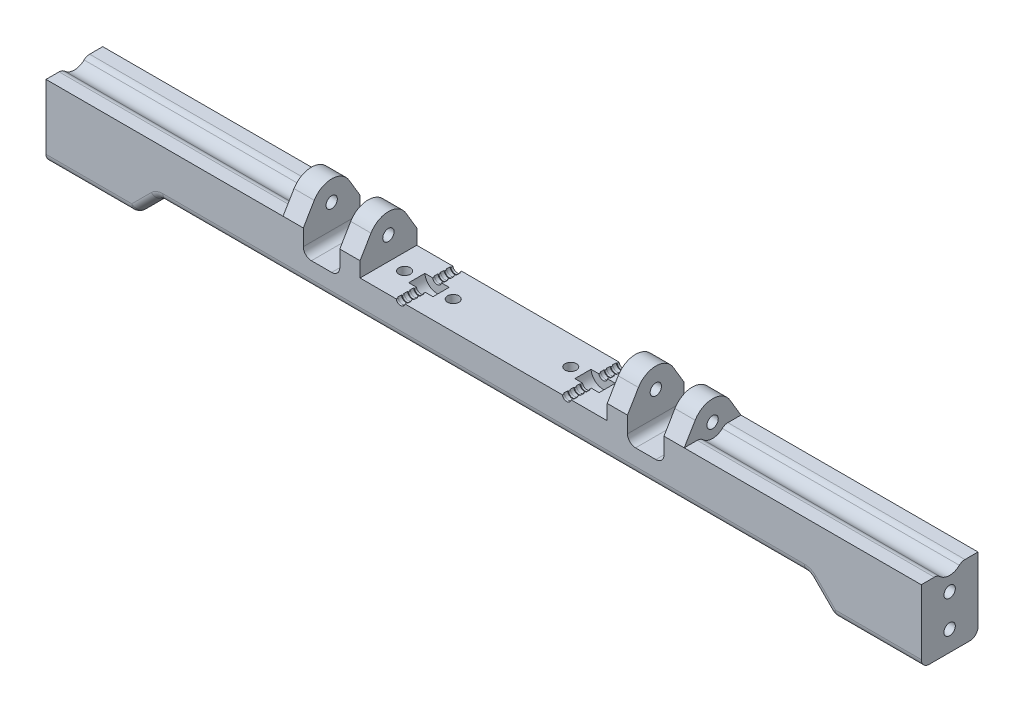
from build123d import *

# Parameters (mm, degrees)
SKETCH1_W           = 17.78
SKETCH1_H           = 22.86
BOSS_EXTRUDE1_DEPTH = 137.16
SKETCH3_R           = 1.778
CUT_EXTRUDE2_DEPTH  = 63.5
SKETCH4_R           = 1.778
BOSS_EXTRUDE2_DEPTH = 6.35
CUT_EXTRUDE3_DEPTH  = 11.43
CUT_EXTRUDE5_DEPTH  = 140.792333123
SKETCH8_R           = 1.778
CUT_EXTRUDE6_DEPTH  = 139.642416385
BOSS_EXTRUDE3_DEPTH = 0.635
LPATTERN1_COUNT     = 10
LPATTERN1_PITCH     = 1.905
SKETCH10_R          = 3.81
CUT_EXTRUDE7_DEPTH  = 2.54
SKETCH11_R          = 4.445
CUT_EXTRUDE8_DEPTH  = 202.250925774
SKETCH12_W          = 203.2
SKETCH12_H          = 7.62
CUT_EXTRUDE9_DEPTH  = 140.792333123
CHAMFER1_SIZE       = 7.62
FILLET1_R           = 2.54


# Read off the part's stored shape, not the designer's step: Mirror2
with BuildPart() as part:
    # Sketch1 → Boss-Extrude1 (new, symmetric)
    with BuildSketch(Plane(origin=(0, 0, 0), x_dir=(0, 0, -1), z_dir=(1, 0, 0))):
        Rectangle(SKETCH1_W, SKETCH1_H)
    extrude(amount=BOSS_EXTRUDE1_DEPTH, both=True)

    # Sketch3 → Cut-Extrude2 (cut)
    with BuildSketch(Plane(origin=(137.16, 0, 0), x_dir=(0, 0, -1), z_dir=(1, 0, 0))):
        with Locations((0, -5.08)):
            Circle(SKETCH3_R)
        with Locations(Location((0, 5.08, 0), (0, 0, 180))):
            Circle(SKETCH3_R)
    extrude(amount=-CUT_EXTRUDE2_DEPTH, mode=Mode.SUBTRACT)

    # Sketch4 → Boss-Extrude2 (add)
    with BuildSketch(Plane(origin=(56.515, 0, 0), x_dir=(0, 0, -1), z_dir=(1, 0, 0))):
        with BuildLine():
            Line((-8.89, 11.43), (-5.461360062, 17.209760218))
            ThreePointArc((-5.461360062, 17.209760218), (0, 20.32), (5.461360062, 17.209760218))
            Line((5.461360062, 17.209760218), (8.89, 11.43))
            Line((8.89, 11.43), (-8.89, 11.43))
        make_face()
        with Locations((0, 13.97)):
            Circle(SKETCH4_R, mode=Mode.SUBTRACT)
    boss_extrude2 = extrude(amount=BOSS_EXTRUDE2_DEPTH)

    # Mirror1: Boss-Extrude2 across plane
    add(boss_extrude2.mirror(Plane.ZY.offset(-50.8)))

    # Sketch5 → Cut-Extrude3 (cut)
    with BuildSketch(Plane(origin=(56.515, 0, 0), x_dir=(0, 0, -1), z_dir=(1, 0, 0))):
        with BuildLine():
            Line((-10.16, 13.97), (-10.16, 3.81))
            Line((-10.16, 3.81), (10.16, 3.81))
            Line((10.16, 3.81), (10.16, 13.97))
            ThreePointArc((10.16, 13.97), (0, 24.13), (-10.16, 13.97))
        make_face()
    extrude(amount=-CUT_EXTRUDE3_DEPTH, mode=Mode.SUBTRACT)

    # Sketch6 → Cut-Extrude5 (cut, through all)
    with BuildSketch(Plane.XY.offset(8.89)):
        with BuildLine():
            ThreePointArc((24.403655463, 6.731), (26.035, 5.334), (27.666344537, 6.731))
            Line((27.666344537, 6.731), (24.403655463, 6.731))
        make_face()
        with BuildLine():
            Line((24.403655463, 6.731), (27.666344537, 6.731))
            ThreePointArc((27.666344537, 6.731), (27.6810788, 6.857620314), (27.686, 6.985))
            ThreePointArc((27.686, 6.985), (25.907620314, 8.6310788), (24.403655463, 6.731))
        make_face()
        with BuildLine():
            Line((27.666344537, 6.731), (38.735, 6.731))
            Line((38.735, 6.731), (38.735, 11.43))
            Line((38.735, 11.43), (0, 11.43))
            Line((0, 11.43), (0, 6.731))
            Line((0, 6.731), (24.403655463, 6.731))
            ThreePointArc((24.403655463, 6.731), (25.907620314, 8.6310788), (27.686, 6.985))
            ThreePointArc((27.686, 6.985), (27.6810788, 6.857620314), (27.666344537, 6.731))
        make_face()
    extrude(amount=-CUT_EXTRUDE5_DEPTH, mode=Mode.SUBTRACT)

    # Sketch8 → Cut-Extrude6 (cut, through all)
    with BuildSketch(Plane(origin=(0, 6.731, 0), x_dir=(1, 0, 0), z_dir=(0, 1, 0))):
        with Locations(Location((18.415, 0, 0), (0, 0, 180))):
            Circle(SKETCH8_R)
        with Locations((33.655, 0)):
            Circle(SKETCH8_R)
    extrude(amount=-CUT_EXTRUDE6_DEPTH, mode=Mode.SUBTRACT)

    # Sketch9 → Boss-Extrude3 (add)
    with BuildSketch(Plane.XY.offset(8.89)):
        with BuildLine():
            Line((24.403655463, 6.731), (24.661284964, 6.731))
            ThreePointArc((24.661284964, 6.731), (26.035, 5.588), (27.408715036, 6.731))
            Line((27.408715036, 6.731), (27.666344537, 6.731))
            ThreePointArc((27.666344537, 6.731), (26.035, 5.334), (24.403655463, 6.731))
        make_face()
    boss_extrude3 = extrude(amount=-BOSS_EXTRUDE3_DEPTH)

    # LPattern1: Boss-Extrude3 ×10
    with Locations(*[(0, 0, -i * LPATTERN1_PITCH) for i in range(1, LPATTERN1_COUNT)]):
        add(boss_extrude3)

    # Sketch10 → Cut-Extrude7 (cut, symmetric)
    with BuildSketch(Plane.XY):
        with Locations((26.035, 6.985)):
            Circle(SKETCH10_R)
    extrude(amount=CUT_EXTRUDE7_DEPTH, both=True, mode=Mode.SUBTRACT)

    # Sketch11 → Cut-Extrude8 (cut, through all)
    with BuildSketch(Plane(origin=(62.865, 0, 0), x_dir=(0, 0, -1), z_dir=(1, 0, 0))):
        with Locations((0, 13.97)):
            Circle(SKETCH11_R)
    extrude(amount=CUT_EXTRUDE8_DEPTH, mode=Mode.SUBTRACT)

    # Mirror2
    split(bisect_by=Plane(origin=(0, 0, 0), x_dir=(0, 0, 1), z_dir=(1, 0, 0)), keep=Keep.TOP)

    # Mirror2 2: part across plane


with BuildPart() as part_1:
    add(part.part)
    add(part.part.mirror(Plane(origin=(0, 0, 0), x_dir=(0, 0, 1), z_dir=(1, 0, 0))))

    # Sketch12 → Cut-Extrude9 (cut, through all)
    with BuildSketch(Plane(origin=(0, 0, -8.89), x_dir=(-1, 0, 0), z_dir=(0, 0, -1))):
        with Locations((0, -7.62)):
            Rectangle(SKETCH12_W, SKETCH12_H)
    extrude(amount=-CUT_EXTRUDE9_DEPTH, mode=Mode.SUBTRACT)

    # Chamfer1
    # the kernel refuses this chamfer: 7.62 mm, written as the material it takes off along each edge
    with BuildSketch(Plane(origin=(-101.6, -11.43, -28.486224368), x_dir=(-0.9996219169112968, -0.02749587661058636, 0), z_dir=(0, 0, 1))) as chamfer1_piece_1:
        Polygon((CHAMFER1_SIZE * 0.999621916911, -CHAMFER1_SIZE * 0.0274958766106), (-CHAMFER1_SIZE * 0.0274958766106, -CHAMFER1_SIZE * 0.999621916911), (0, 0), align=None)
    extrude(amount=56.972448737, mode=Mode.SUBTRACT)
    with BuildSketch(Plane(origin=(101.6, -11.43, -28.486224368), x_dir=(0.9996219169112968, -0.02749587661058636, 0), z_dir=(0, 0, 1))) as chamfer1_piece_2:
        Polygon((CHAMFER1_SIZE * 0.999621916911, CHAMFER1_SIZE * 0.0274958766106), (-CHAMFER1_SIZE * 0.0274958766106, CHAMFER1_SIZE * 0.999621916911), (0, 0), align=None)
    extrude(amount=56.972448737, mode=Mode.SUBTRACT)

    # Fillet1
    fillet1_edges = [part_1.edges().sort_by_distance(p)[0] for p in [
        (100.0125, 11.43, -3.647797281),
        (100.0125, 11.43, 3.647797281),
        (-56.515, 3.81, 0),
        (-45.085, 3.81, 0),
        (-100.0125, 11.43, 3.647797281),
        (-100.0125, 11.43, -3.647797281),
        (101.6, -3.81, 5.067170395),
        (0, -3.81, 8.89),
        (-101.6, -3.81, 5.067170395),
        (0, -3.81, -8.89),
        (123.19, -11.43, -8.89),
        (105.41, -7.62, -8.89),
        (-105.41, -7.62, -8.89),
        (-109.22, -11.43, 0),
        (123.19, -11.43, 8.89),
        (105.41, -7.62, 8.89),
        (-105.41, -7.62, 8.89),
        (109.22, -11.43, 0),
        (56.515, 3.81, 0),
        (45.085, 3.81, 0),
        (-123.19, -11.43, -8.89),
        (-123.19, -11.43, 8.89),
    ]]
    fillet(fillet1_edges, radius=FILLET1_R)


solid = part_1.part
